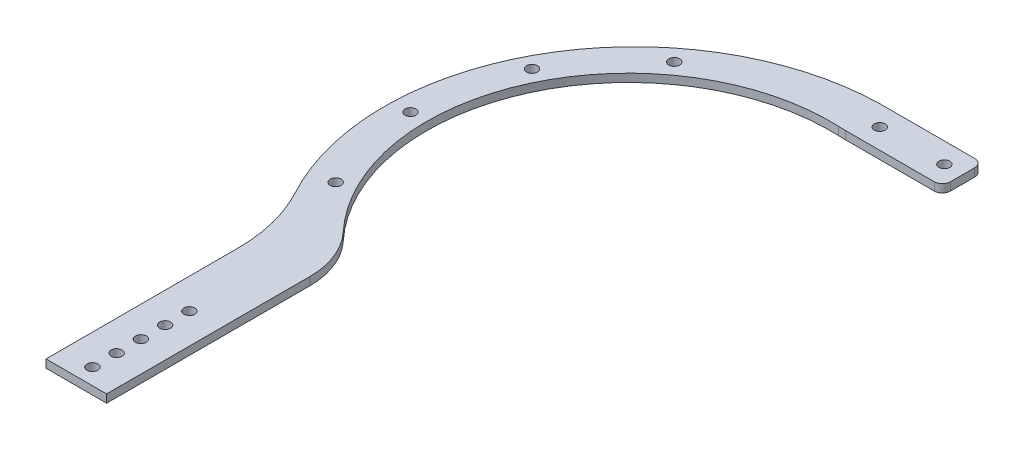
from build123d import *

# Parameters (mm, degrees)
SKETCH_1_W      = 25
SKETCH_1_H      = 10
SKETCH_1_R      = 1.35
EXTRUDE_1_DEPTH = 2
SKETCH_3_R      = 1.35
EXTRUDE_2_DEPTH = 2
FILLET_2_R      = 40
FILLET_2_R_2    = 20
FILLET_2_R_3    = 30
FILLET_4_R      = 2


with BuildPart() as part:
    # 草图1 → 凸台-拉伸1 (new body)
    with BuildSketch(Plane(origin=(0, 0, 0), x_dir=(1, 0, 0), z_dir=(0, 1, 0))):
        Rectangle(SKETCH_1_W, SKETCH_1_H)
        with Locations(Location((8, 0, 0), (0, 0, 270))):
            Circle(SKETCH_1_R, mode=Mode.SUBTRACT)
        with Locations(Location((-8, 0, 0), (0, 0, 270))):
            Circle(SKETCH_1_R, mode=Mode.SUBTRACT)
    extrude(amount=EXTRUDE_1_DEPTH)

    # 草图3 → 凸台-拉伸2 (add)
    with BuildSketch(Plane(origin=(0, 2, 0), x_dir=(1, 0, 0), z_dir=(0, 1, 0))):
        with BuildLine():
            Line((-12.5, 5), (-12.5, -5))
            ThreePointArc((-12.5, -5), (-62.017500377, -37.077584126), (-46.5, -94))
            Line((-46.5, -94), (-46.5, -153))
            Line((-46.5, -153), (-61.5, -153))
            Line((-61.5, -153), (-61.5, -94))
            ThreePointArc((-61.5, -94), (-67.320253247, -29.493005969), (-12.5, 5))
        make_face()
        with Locations(Location((-54, -149, 0), (0, 0, 270))):
            Circle(SKETCH_3_R, mode=Mode.SUBTRACT)
        with Locations(Location((-63.522724498, -79.241972734, 0), (0, 0, 270))):
            Circle(SKETCH_3_R, mode=Mode.SUBTRACT)
        with Locations(Location((-47.401976264, -11.491855125, 0), (0, 0, 270))):
            Circle(SKETCH_3_R, mode=Mode.SUBTRACT)
        with Locations(Location((-69.309761535, -54.920989975, 0), (0, 0, 270))):
            Circle(SKETCH_3_R, mode=Mode.SUBTRACT)
        with Locations(Location((-63.522724498, -30.600007217, 0), (0, 0, 270))):
            Circle(SKETCH_3_R, mode=Mode.SUBTRACT)
        with Locations(Location((-54, -143, 0), (0, 0, 270))):
            Circle(SKETCH_3_R, mode=Mode.SUBTRACT)
        with Locations(Location((-54, -137, 0), (0, 0, 270))):
            Circle(SKETCH_3_R, mode=Mode.SUBTRACT)
        with Locations(Location((-54, -131, 0), (0, 0, 270))):
            Circle(SKETCH_3_R, mode=Mode.SUBTRACT)
        with Locations(Location((-54, -125, 0), (0, 0, 270))):
            Circle(SKETCH_3_R, mode=Mode.SUBTRACT)
    extrude(amount=-EXTRUDE_2_DEPTH)

    # 圆角2
    # the kernel refuses this fillet: 40, 30, 20 mm, written as the material it adds along each edge
    with BuildSketch(Plane(origin=(-61.5, 2, 94), x_dir=(0, 0, 1), z_dir=(0, -1, 0))) as fillet_2_piece_1:
        with BuildLine():
            CenterArc((11.468694882, 40), FILLET_2_R, 241.625850179, 28.374149821)
            ThreePointArc((-7.540396677, 4.805477158), (-3.683456175, 2.538847918), (0, 0))
            Line((0, 0), (11.468694882, 0))
        make_face()
    extrude(amount=2)
    # the kernel refuses this fillet: 40, 30, 20 mm, written as the material it takes off along each edge
    with BuildSketch(Plane(origin=(-46.5, 23.664306304, 94), x_dir=(-0.733794554453268, 0, -0.6793714387981952), z_dir=(0, -1, 0))) as fillet_2_2_piece_1:
        with BuildLine():
            CenterArc((8.788646711, -19.946288773), FILLET_2_R_2, 94.200030188, 43.005425253)
            Line((-5.887244378, -6.358859997), (0, 0))
            ThreePointArc((0, 0), (3.66193613, -0.134278068), (7.323872259, 0))
        make_face()
    extrude(amount=45.328612608, mode=Mode.SUBTRACT)
    with BuildSketch(Plane(origin=(-12.5, -2.4014787, 5), x_dir=(1, 0, 0), z_dir=(0, 1, 0))) as fillet_2_2_piece_2:
        with BuildLine():
            CenterArc((0.96059148, 40), FILLET_2_R, 267.599016081, 2.400983919)
            ThreePointArc((-0.715120971, 0.035115567), (-0.357497629, 0.018837835), (0, 0))
            Line((0, 0), (0.96059148, 0))
        make_face()
    extrude(amount=6.8029574, mode=Mode.SUBTRACT)
    with BuildSketch(Plane(origin=(-12.5, -0.73103436, -5), x_dir=(1, 0, 0), z_dir=(0, 1, 0))) as fillet_2_2_piece_3:
        with BuildLine():
            CenterArc((0.210076235, -30), FILLET_2_R_3, 90, 0.959672209)
            ThreePointArc((-0.292383464, -0.004208058), (-0.146194213, -0.001931656), (0, 0))
            Line((0, 0), (0.210076235, 0))
        make_face()
    extrude(amount=3.462068721, mode=Mode.SUBTRACT)

    # 圆角4
    fillet_4_edges = [part.edges().sort_by_distance(p)[0] for p in [
        (12.5, 1, 5),
        (12.5, 1, -5),
    ]]
    fillet(fillet_4_edges, radius=FILLET_4_R)


solid = part.part
